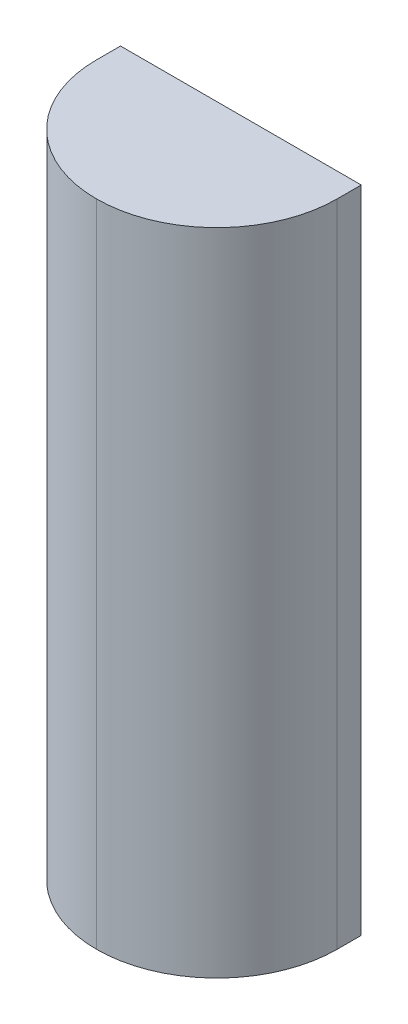
from build123d import *

# Parameters (mm, degrees)
CROQUIS1_W              = 1
CROQUIS1_H              = 2.7
SALIENTE_EXTRUIR1_DEPTH = 0.6
REDONDEO1_R             = 0.5


with BuildPart() as part:
    # Croquis1 → Saliente-Extruir1 (new body)
    with BuildSketch(Plane.XY):
        with Locations((1.85, 0)):
            Rectangle(CROQUIS1_W, CROQUIS1_H)
    extrude(amount=SALIENTE_EXTRUIR1_DEPTH)

    # Redondeo1
    redondeo1_edges = [part.edges().sort_by_distance(p)[0] for p in [
        (2.35, 0, 0.6),
        (1.35, 0, 0.6),
    ]]
    fillet(redondeo1_edges, radius=REDONDEO1_R - 0.0001)  # a hair under: the kernel refuses the full size


solid = part.part
